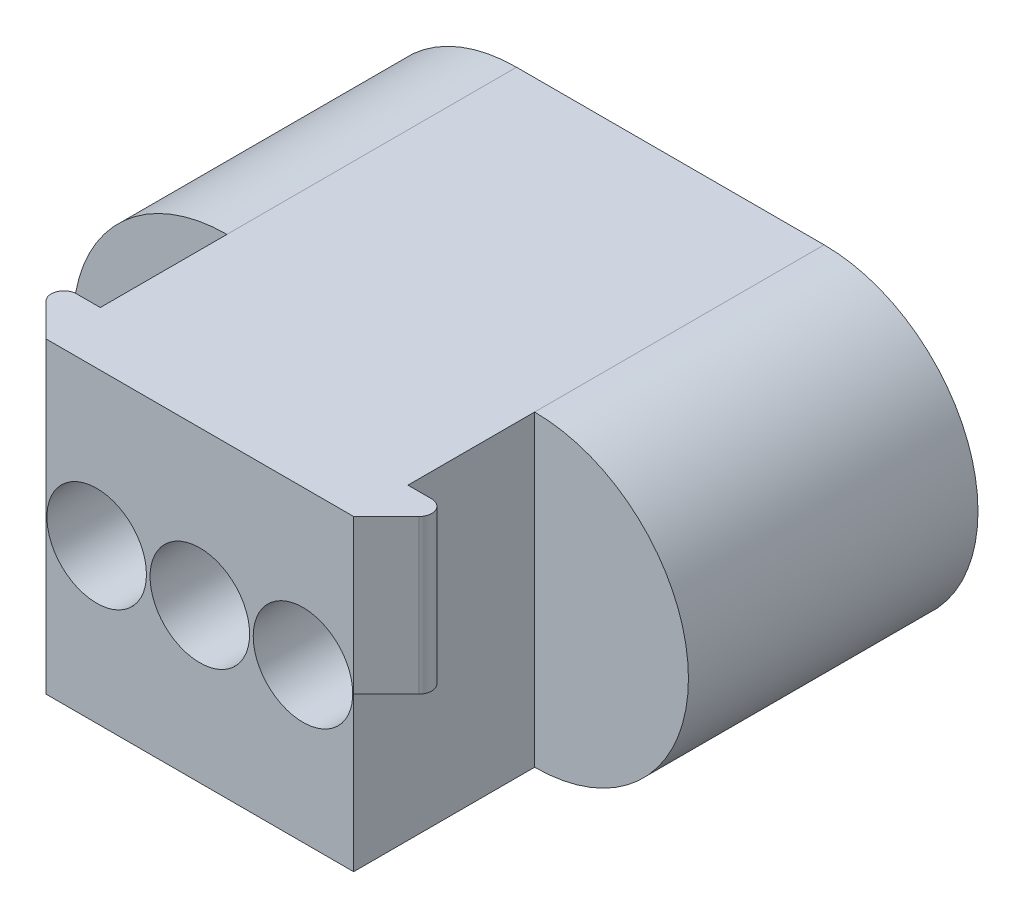
from build123d import *

# Parameters (mm, degrees)
EXTRUDE_1_DEPTH      = 26
CUT_EXTRUDE_START    = -10
CUT_EXTRUDE_1_DEPTH  = 10
SKETCH_3_W           = 3
SKETCH_3_H           = 8.5
EXTRUDE_2_DEPTH      = 3
CUT_EXTRUDE_2_REACH  = 37.412
SKETCH_5_W           = 3
SKETCH_5_H           = 8.5
EXTRUDE_3_DEPTH      = 3
CUT_EXTRUDE_3_REACH  = 37.412
SKETCH_7_W           = 11
SKETCH_7_H           = 20
CUT_EXTRUDE_4_DEPTH  = 2
FILLET_3_R           = 1
FILLET_4_R           = 1
SKETCH_10_W          = 15
SKETCH_10_H          = 7
CUT_EXTRUDE_5_DEPTH  = 2
CUT_EXTRUDE_START_2  = -4
CUT_EXTRUDE_6_DEPTH  = 4
FILLET_5_R           = 0.5
FILLET_6_R           = 0.5
FILLET_7_R           = 1
FILLET_9_R           = 0.7
FILLET_10_R          = 0.7
SKETCH_12_W          = 3
SKETCH_12_H          = 4
CUT_EXTRUDE_7_DEPTH  = 4
FILLET_11_R          = 1.5
FILLET_12_R          = 0.5
SKETCH_13_R          = 2.75
CUT_EXTRUDE_16_DEPTH = 10
SKETCH_14_W          = 17
SKETCH_14_H          = 3
CUT_EXTRUDE_20_DEPTH = 15
FILLET_13_R          = 0.7
SKETCH_15_W          = 1.5
SKETCH_15_H          = 2
CUT_EXTRUDE_22_DEPTH = 15


with BuildPart() as part:
    # ｽｹｯﾁ1 → ﾎﾞｽ - 押し出し1 (new body)
    with BuildSketch(Plane.XY):
        with BuildLine():
            Line((8.5, -8.5), (-8.5, -8.5))
            ThreePointArc((-8.5, -8.5), (-17, 0), (-8.5, 8.5))
            Line((-8.5, 8.5), (8.5, 8.5))
            ThreePointArc((8.5, 8.5), (17, 0), (8.5, -8.5))
        make_face()
    extrude(amount=EXTRUDE_1_DEPTH)

    # ｽｹｯﾁ2 → ｶｯﾄ - 押し出し1 (cut)
    with BuildSketch(Plane.XY.offset(26).offset(CUT_EXTRUDE_START)):
        with BuildLine():
            Line((-8.5, 8.5), (-8.5, -8.5))
            ThreePointArc((-8.5, -8.5), (-17, 0), (-8.5, 8.5))
        make_face()
        with BuildLine():
            Line((8.5, 8.5), (8.5, -8.5))
            ThreePointArc((8.5, -8.5), (17, 0), (8.5, 8.5))
        make_face()
    extrude(amount=CUT_EXTRUDE_1_DEPTH, mode=Mode.SUBTRACT)

    # ｽｹｯﾁ3 → ﾎﾞｽ - 押し出し2 (add)
    with BuildSketch(Plane(origin=(8.5, 0, 0), x_dir=(0, 0, -1), z_dir=(1, 0, 0))):
        with Locations((-24.5, 4.25)):
            Rectangle(SKETCH_3_W, SKETCH_3_H)
    extrude(amount=EXTRUDE_2_DEPTH)

    # ｽｹｯﾁ4 → ｶｯﾄ - 押し出し2 (cut, up to next)
    with BuildSketch(Plane(origin=(0, 8.5, 0), x_dir=(1, 0, 0), z_dir=(0, 1, 0)), mode=Mode.PRIVATE) as cut_extrude_2_sk1:
        Polygon((11.5, -23), (11.5, -26), (8.5, -26), align=None)
    cut_extrude_2_tool1 = extrude(cut_extrude_2_sk1.sketch, amount=-CUT_EXTRUDE_2_REACH, mode=Mode.PRIVATE) & part.part
    add(cut_extrude_2_tool1.solids().sort_by_distance((10.5, 8.5, 25))[0], mode=Mode.SUBTRACT)

    # ｽｹｯﾁ5 → ﾎﾞｽ - 押し出し3 (add)
    with BuildSketch(Plane.ZY.offset(8.5)):
        with Locations((24.5, 4.25)):
            Rectangle(SKETCH_5_W, SKETCH_5_H)
    extrude(amount=EXTRUDE_3_DEPTH)

    # ｽｹｯﾁ6 → ｶｯﾄ - 押し出し3 (cut, up to next)
    with BuildSketch(Plane(origin=(0, 8.5, 0), x_dir=(1, 0, 0), z_dir=(0, 1, 0)), mode=Mode.PRIVATE) as cut_extrude_3_sk1:
        Polygon((-11.5, -26), (-11.5, -23), (-8.5, -26), align=None)
    cut_extrude_3_tool1 = extrude(cut_extrude_3_sk1.sketch, amount=-CUT_EXTRUDE_3_REACH, mode=Mode.PRIVATE) & part.part
    add(cut_extrude_3_tool1.solids().sort_by_distance((-10.5, 8.5, 25))[0], mode=Mode.SUBTRACT)

    # ｽｹｯﾁ7 → ｶｯﾄ - 押し出し4 (cut)
    with BuildSketch(Plane.XZ.offset(8.5)):
        with Locations((0, 13)):
            Rectangle(SKETCH_7_W, SKETCH_7_H)
    extrude(amount=-CUT_EXTRUDE_4_DEPTH, mode=Mode.SUBTRACT)

    # ﾌｨﾚｯﾄ3
    fillet_3_edges = [part.edges().sort_by_distance(p)[0] for p in [
        (5.5, -7.5, 3),
    ]]
    fillet(fillet_3_edges, radius=FILLET_3_R)

    # ﾌｨﾚｯﾄ4
    fillet_4_edges = [part.edges().sort_by_distance(p)[0] for p in [
        (-5.5, -7.5, 3),
    ]]
    fillet(fillet_4_edges, radius=FILLET_4_R)

    # ｽｹｯﾁ10 → ｶｯﾄ - 押し出し5 (cut)
    with BuildSketch(Plane.XZ.offset(8.5)):
        with Locations((0, 19.5)):
            Rectangle(SKETCH_10_W, SKETCH_10_H)
    extrude(amount=-CUT_EXTRUDE_5_DEPTH, mode=Mode.SUBTRACT)

    # ｽｹｯﾁ11 → ｶｯﾄ - 押し出し6 (cut)
    with BuildSketch(Plane.XZ.offset(8.5).offset(CUT_EXTRUDE_START_2)):
        with BuildLine():
            Line((6.5, 21), (3.5, 21))
            Line((3.5, 21), (3.5, 5))
            Line((3.5, 5), (0, 5))
            Line((0, 5), (0, 3.001563835))
            Line((0, 3.001563835), (4.5, 3))
            ThreePointArc((4.5, 3), (5.207106781, 3.292893219), (5.5, 4))
            Line((5.5, 4), (5.5, 16))
            Line((5.5, 16), (6.5, 16))
            Line((6.5, 16), (6.5, 21))
        make_face()
    cut_extrude_6 = extrude(amount=CUT_EXTRUDE_6_DEPTH, mode=Mode.SUBTRACT)

    # ﾐﾗｰ1: ｶｯﾄ - 押し出し6 across plane
    add(cut_extrude_6.mirror(Plane(origin=(0, 0, 0), x_dir=(0, 0, 1), z_dir=(1, 0, 0))), mode=Mode.SUBTRACT)

    # ﾌｨﾚｯﾄ5
    fillet_5_edges = [part.edges().sort_by_distance(p)[0] for p in [
        (3.5, -5.5, 5),
    ]]
    fillet(fillet_5_edges, radius=FILLET_5_R)

    # ﾌｨﾚｯﾄ6
    fillet_6_edges = [part.edges().sort_by_distance(p)[0] for p in [
        (-3.5, -5.5, 5),
    ]]
    fillet(fillet_6_edges, radius=FILLET_6_R)

    # ﾌｨﾚｯﾄ7
    fillet_7_edges = [part.edges().sort_by_distance(p)[0] for p in [
        (3.5, -5.5, 21),
        (6.5, -5.5, 21),
        (-6.5, -5.5, 21),
        (-3.5, -5.5, 21),
    ]]
    fillet(fillet_7_edges, radius=FILLET_7_R)

    # ﾌｨﾚｯﾄ9
    fillet_9_edges = [part.edges().sort_by_distance(p)[0] for p in [
        (-11.5, 4.25, 23),
    ]]
    fillet(fillet_9_edges, radius=FILLET_9_R)

    # ﾌｨﾚｯﾄ10
    fillet_10_edges = [part.edges().sort_by_distance(p)[0] for p in [
        (11.5, 4.25, 23),
    ]]
    fillet(fillet_10_edges, radius=FILLET_10_R)

    # ｽｹｯﾁ12 → ｶｯﾄ - 押し出し7 (cut)
    with BuildSketch(Plane.XZ.offset(8.5)):
        with Locations((0, 9)):
            Rectangle(SKETCH_12_W, SKETCH_12_H)
    extrude(amount=-CUT_EXTRUDE_7_DEPTH, mode=Mode.SUBTRACT)

    # ﾌｨﾚｯﾄ11
    fillet_11_edges = [part.edges().sort_by_distance(p)[0] for p in [
        (0, -6.5, 23),
    ]]
    fillet(fillet_11_edges, radius=FILLET_11_R)

    # ﾌｨﾚｯﾄ12
    fillet_12_edges = [part.edges().sort_by_distance(p)[0] for p in [
        (0, -8.5, 23),
    ]]
    fillet(fillet_12_edges, radius=FILLET_12_R - 0.0001)  # a hair under: the kernel refuses the full size

    # ｽｹｯﾁ13 → ｶｯﾄ - 押し出し16 (cut)
    with BuildSketch(Plane.XY.offset(26)):
        Circle(SKETCH_13_R)
        with Locations((-5.7, 0)):
            Circle(SKETCH_13_R)
        with Locations(Location((5.7, 0, 0), (0, 0, 180))):
            Circle(SKETCH_13_R)
    extrude(amount=-CUT_EXTRUDE_16_DEPTH, mode=Mode.SUBTRACT)

    # ｽｹｯﾁ14 → ｶｯﾄ - 押し出し20 (cut)
    with BuildSketch(Plane(origin=(0, 0, 0), x_dir=(-1, 0, 0), z_dir=(0, 0, -1))):
        with BuildLine():
            Line((8.5, -6), (-8.5, -6))
            ThreePointArc((-8.5, -6), (-14.5, 0), (-8.5, 6))
            Line((-8.5, 6), (8.5, 6))
            ThreePointArc((8.5, 6), (14.5, 0), (8.5, -6))
        make_face()
        Rectangle(SKETCH_14_W, SKETCH_14_H, mode=Mode.SUBTRACT)
    extrude(amount=-CUT_EXTRUDE_20_DEPTH, mode=Mode.SUBTRACT)

    # ﾌｨﾚｯﾄ13
    fillet_13_edges = [part.edges().sort_by_distance(p)[0] for p in [
        (8.5, 1.5, 7.5),
        (-8.5, 1.5, 7.5),
        (-8.5, -1.5, 7.5),
        (8.5, -1.5, 7.5),
    ]]
    fillet(fillet_13_edges, radius=FILLET_13_R)

    # ｽｹｯﾁ15 → ｶｯﾄ - 押し出し22 (cut)
    with BuildSketch(Plane(origin=(0, 0, 0), x_dir=(-1, 0, 0), z_dir=(0, 0, -1))):
        with Locations((-6.75, 0)):
            Rectangle(SKETCH_15_W, SKETCH_15_H)
        with Locations((6.75, 0)):
            Rectangle(SKETCH_15_W, SKETCH_15_H)
        Rectangle(SKETCH_15_W, SKETCH_15_H)
    extrude(amount=-CUT_EXTRUDE_22_DEPTH, mode=Mode.SUBTRACT)


solid = part.part
